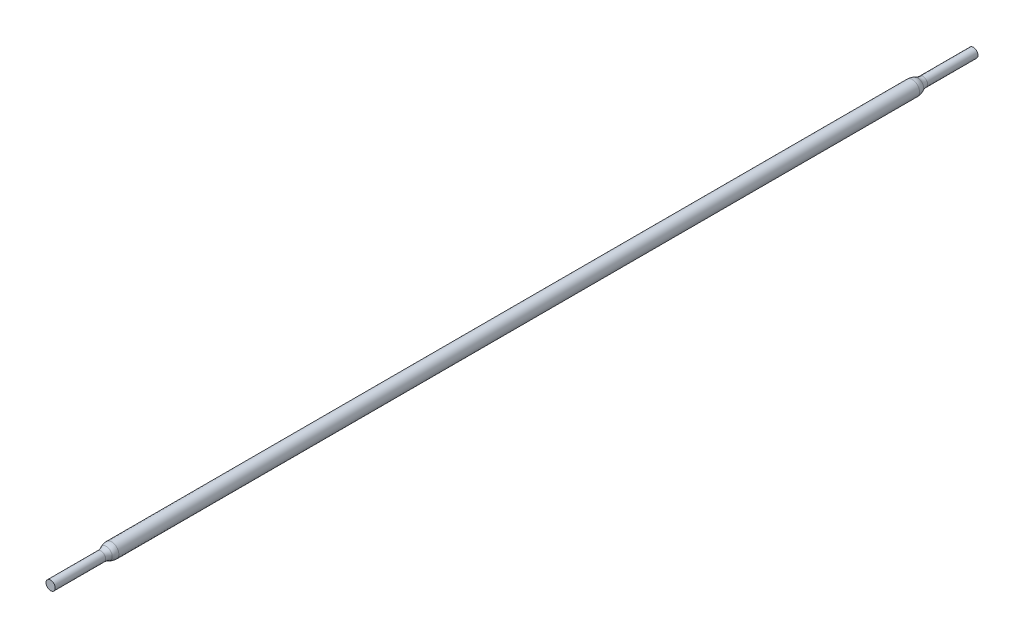
from build123d import *

# Parameters (mm, degrees)
SKETCH1_R           = 4
BOSS_EXTRUDE1_DEPTH = 50
SKETCH2_R           = 6.25
BOSS_EXTRUDE2_DEPTH = 700
SKETCH3_R           = 4
BOSS_EXTRUDE3_DEPTH = 50
FILLET1_R           = 10
FILLET2_R           = 10


with BuildPart() as part:
    # Sketch1 → Boss-Extrude1 (new body)
    with BuildSketch(Plane.XY):
        Circle(SKETCH1_R)
    extrude(amount=BOSS_EXTRUDE1_DEPTH)

    # Sketch2 → Boss-Extrude2 (add)
    with BuildSketch(Plane.XY.offset(50)):
        Circle(SKETCH2_R)
    extrude(amount=BOSS_EXTRUDE2_DEPTH)

    # Sketch3 → Boss-Extrude3 (add)
    with BuildSketch(Plane.XY.offset(750)):
        Circle(SKETCH3_R)
    extrude(amount=BOSS_EXTRUDE3_DEPTH)

    # Fillet1
    # the kernel refuses this fillet: 10 mm, written as the material it adds along each edge
    with BuildSketch(Plane(origin=(0, 0, 750), x_dir=(1, 0, 0), z_dir=(0, -1, 0))) as fillet1_piece_1:
        with BuildLine():
            CenterArc((14, 6.31961233), FILLET1_R, 180, 39.194967426)
            Line((4, 6.31961233), (3.8, 6.31961233))
            Line((3.8, 6.31961233), (3.8, 0))
            Line((3.8, 0), (4, -0.2))
            ThreePointArc((4, -0.2), (5.125, -0.2), (6.095, -0.126392247))
            Line((6.095, -0.126392247), (6.25, 0))
        make_face()
    revolve(axis=Axis((0, 0, 750), (0, 0, 1)))
    with BuildSketch(Plane(origin=(0, 0, 50), x_dir=(1, 0, 0), z_dir=(0, -1, 0))) as fillet1_piece_2:
        with BuildLine():
            CenterArc((14, -6.31961233), FILLET1_R, 140.805032574, 39.194967426)
            Line((4, -6.31961233), (3.8, -6.31961233))
            Line((3.8, -6.31961233), (3.8, 0))
            Line((3.8, 0), (4, 0.2))
            ThreePointArc((4, 0.2), (5.125, 0.2), (6.095, 0.126392247))
            Line((6.095, 0.126392247), (6.25, 0))
        make_face()
    revolve(axis=Axis((0, 0, 50), (0, 0, 1)))

    # Fillet2
    fillet2_edges = [part.edges().sort_by_distance(p)[0] for p in [
        (-6.25, 0, 50),
        (-6.25, 0, 750),
    ]]
    fillet(fillet2_edges, radius=FILLET2_R)


solid = part.part
